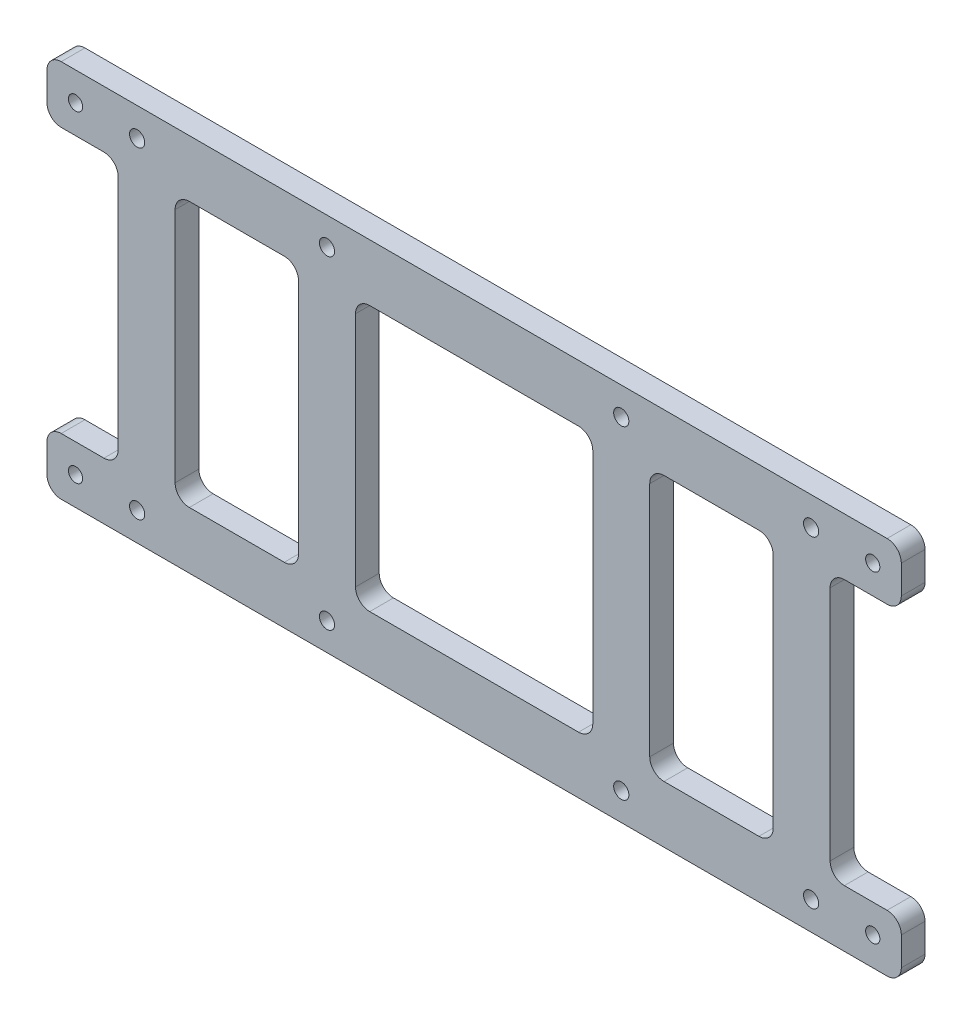
from build123d import *

# Parameters (mm, degrees)
EXTRUDE_1_DEPTH     = 5
FILLET_1_R          = 3
SKETCH_2_R          = 1.5
SKETCH_2_R_2        = 1.6
CUT_EXTRUDE_1_DEPTH = 7
SKETCH_3_W          = 12
SKETCH_3_H          = 55.843243592
EXTRUDE_2_DEPTH     = 5
FILLET_2_R          = 3


with BuildPart() as part:
    # 草图1 → 凸台-拉伸1 (new body)
    with BuildSketch(Plane.XY):
        with BuildLine():
            Line((-20, 27.843243592), (-8, 27.843243592))
            Line((-8, 27.843243592), (-8, -28))
            Line((-8, -28), (-20, -28))
            ThreePointArc((-20, -28), (-22.121320344, -28.878679656), (-23, -31))
            Line((-23, -31), (-23, -37))
            ThreePointArc((-23, -37), (-22.121320344, -39.121320344), (-20, -40))
            Line((-20, -40), (154, -40))
            ThreePointArc((154, -40), (156.121320344, -39.121320344), (157, -37))
            Line((157, -37), (157, -31))
            ThreePointArc((157, -31), (156.121320344, -28.878679656), (154, -28))
            Line((154, -28), (142, -28))
            Line((142, -28), (142, 27.843243592))
            Line((142, 27.843243592), (154, 27.843243592))
            ThreePointArc((154, 27.843243592), (156.121320344, 28.721923248), (157, 30.843243592))
            Line((157, 30.843243592), (157, 36.843243592))
            ThreePointArc((157, 36.843243592), (156.121320344, 38.964563935), (154, 39.843243592))
            Line((154, 39.843243592), (142, 39.843243592))
            Line((142, 39.843243592), (-8, 39.843243592))
            Line((-8, 39.843243592), (-20, 39.843243592))
            ThreePointArc((-20, 39.843243592), (-22.121320344, 38.964563935), (-23, 36.843243592))
            Line((-23, 36.843243592), (-23, 30.843243592))
            ThreePointArc((-23, 30.843243592), (-22.121320344, 28.721923248), (-20, 27.843243592))
        make_face()
        with BuildLine():
            ThreePointArc((4, 24.843243592), (4.878679656, 26.964563935), (7, 27.843243592))
            Line((7, 27.843243592), (127, 27.843243592))
            ThreePointArc((127, 27.843243592), (129.121320344, 26.964563935), (130, 24.843243592))
            Line((130, 24.843243592), (130, -25))
            ThreePointArc((130, -25), (129.121320344, -27.121320344), (127, -28))
            Line((127, -28), (7, -28))
            ThreePointArc((7, -28), (4.878679656, -27.121320344), (4, -25))
            Line((4, -25), (4, 24.843243592))
        make_face(mode=Mode.SUBTRACT)
    extrude(amount=EXTRUDE_1_DEPTH)

    # 圆角1
    fillet_1_edges = [part.edges().sort_by_distance(p)[0] for p in [
        (-8, -28, 2.5),
        (-8, 27.843243592, 2.5),
        (142, -28, 2.5),
        (142, 27.843243592, 2.5),
    ]]
    fillet(fillet_1_edges, radius=FILLET_1_R)

    # 草图2 → 切除-拉伸1 (cut)
    with BuildSketch(Plane.XY.offset(5)):
        with Locations((-16.977965312, 33.843243592)):
            Circle(SKETCH_2_R)
        with Locations((-4, 33.843243592)):
            Circle(SKETCH_2_R_2)
        with Locations((36.001599808, 34)):
            Circle(SKETCH_2_R_2)
        with Locations((97.998400192, 34)):
            Circle(SKETCH_2_R_2)
        with Locations((138, 33.843243592)):
            Circle(SKETCH_2_R_2)
        with Locations((150.977965312, 33.843243592)):
            Circle(SKETCH_2_R)
        with Locations((150.977965312, -34)):
            Circle(SKETCH_2_R)
        with Locations((138, -34)):
            Circle(SKETCH_2_R_2)
        with Locations((97.998400192, -34.156756408)):
            Circle(SKETCH_2_R_2)
        with Locations((36.001599808, -34.156756408)):
            Circle(SKETCH_2_R_2)
        with Locations((-4, -34)):
            Circle(SKETCH_2_R_2)
        with Locations((-16.977965312, -34)):
            Circle(SKETCH_2_R)
    extrude(amount=-CUT_EXTRUDE_1_DEPTH, mode=Mode.SUBTRACT)

    # 草图3 → 凸台-拉伸2 (add)
    with BuildSketch(Plane(origin=(0, 0, 0), x_dir=(-1, 0, 0), z_dir=(0, 0, -1))):
        with Locations((-97.998400192, -0.078378204)):
            Rectangle(SKETCH_3_W, SKETCH_3_H)
        with Locations((-36.001599808, -0.078378204)):
            Rectangle(SKETCH_3_W, SKETCH_3_H)
    extrude(amount=-EXTRUDE_2_DEPTH)

    # 圆角2
    fillet_2_edges = [part.edges().sort_by_distance(p)[0] for p in [
        (42.001599808, 27.843243592, 2.5),
        (42.001599808, -28, 2.5),
        (91.998400192, -28, 2.5),
        (30.001599808, -28, 2.5),
        (30.001599808, 27.843243592, 2.5),
        (91.998400192, 27.843243592, 2.5),
        (103.998400192, -28, 2.5),
        (103.998400192, 27.843243592, 2.5),
    ]]
    fillet(fillet_2_edges, radius=FILLET_2_R)


solid = part.part
